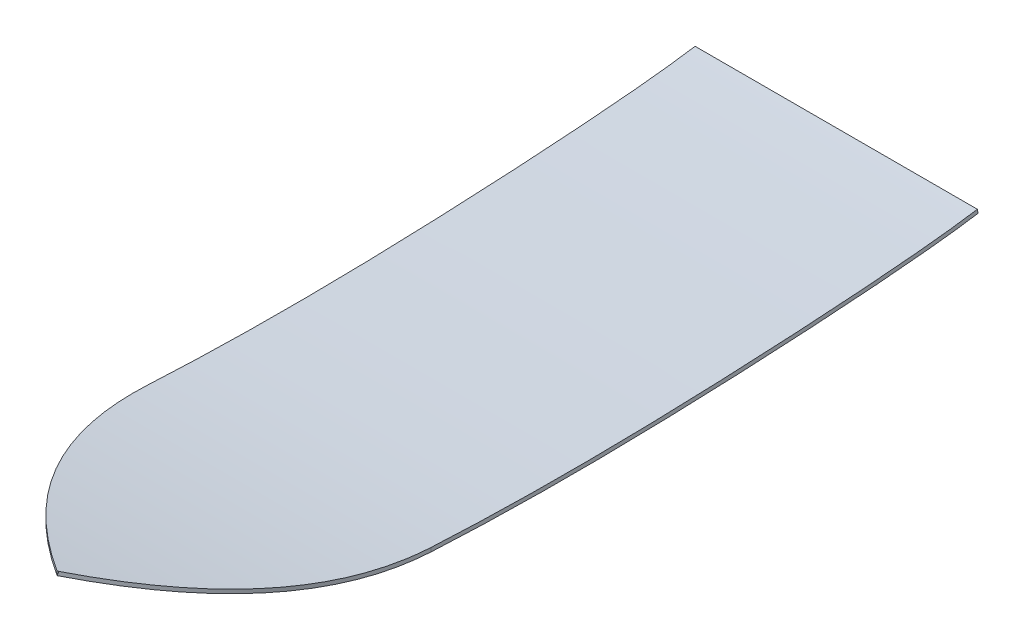
from build123d import *

# Parameters (mm, degrees)
BOSS_EXTRUDE1_DEPTH      = 1524
BOSS_EXTRUDE1_DEPTH_BACK = 1524
CUT_EXTRUDE1_START       = -208
CUT_EXTRUDE1_OUTLINE_W   = 5731.457351091
CUT_EXTRUDE1_OUTLINE_H   = 8003.30588206
CUT_EXTRUDE1_DEPTH       = 209.886455024


with BuildPart() as part:
    # Sketch1 → Boss-Extrude1 (new, two sides: drawn at the far end of the back side and taken through both)
    with BuildSketch(Plane(origin=(0, 0, 0), x_dir=(0, 0, -1), z_dir=(1, 0, 0)).offset(-BOSS_EXTRUDE1_DEPTH_BACK)):
        with BuildLine():
            Line((-2455.705706157, 1.886455024), (-2459.805173453, -22.775142003))
            add(Edge.make_bspline(
                [(-2459.805173453, -22.775142003), (-2441.946686763, -25.743736537), (-2406.205230752, -31.609959996), (-2334.773178672, -43.032277675), (-2209.618030301, -62.250736017), (-2029.595399572, -87.611965707), (-1808.500527735, -114.962754568), (-1616.94740553, -135.317673387), (-1456.702961413, -150.159527585), (-1332.105867361, -160.560262072), (-1223.653948308, -168.603284556), (-1133.367307109, -174.644468748), (-1063.594957076, -178.973267411), (-991.610471894, -183.085221305), (-917.815966885, -186.931442089), (-842.05530735, -190.499530364), (-738.409008772, -194.85598638), (-603.836327416, -199.497545977), (-434.25509535, -203.611966523), (-256.82554217, -206.111379763), (-72.134614073, -206.864893086), (118.81899413, -205.789897599), (314.680946002, -202.868887944), (513.786201944, -198.160071187), (680.992513347, -192.849250504), (814.596522023, -187.864069547), (914.664696552, -183.777270027), (1014.05635537, -179.386503754), (1113.694123204, -174.669692667), (1214.254765944, -169.586653864), (1314.889722078, -164.167290551), (1415.354549259, -158.413962463), (1548.483868307, -150.313072281), (1712.279598249, -139.407922223), (1869.84170335, -127.530715574), (1990.474404012, -117.487059967), (2077.822455966, -109.693479785), (2161.626793075, -101.648998079), (2241.472619675, -93.363479094), (2304.368154422, -86.265806167), (2352.294337899, -80.476044551), (2386.993215338, -76.078820919), (2420.395849105, -71.62753036), (2447.11008498, -67.873534527), (2467.783160775, -64.843949002), (2482.935225878, -62.558183335), (2495.254609712, -60.643431227), (2504.941628256, -59.10257227), (2509.69639179, -58.334346222), (2512.084137374, -57.94546148)],
                knots=[0.00425288, 0.00425288, 0.00425288, 0.00425288, 0.019811429, 0.035369978, 0.066487075, 0.12872127, 0.190955465, 0.25318966, 0.284306758, 0.315423855, 0.346540953, 0.362099501, 0.37765805, 0.393216599, 0.408775148, 0.424333696, 0.439892245, 0.471009343, 0.50212644, 0.533243538, 0.564360635, 0.595477733, 0.62659483, 0.657711928, 0.688829025, 0.704387574, 0.719946123, 0.735504671, 0.75106322, 0.766621769, 0.782180318, 0.797738866, 0.813297415, 0.844414513, 0.87553161, 0.891090159, 0.906648708, 0.922207256, 0.937765805, 0.953324354, 0.961103628, 0.968882903, 0.976662177, 0.984441451, 0.988331088, 0.992220726, 0.996110363, 0.998055181, 1, 1, 1, 1], degree=3))
            Line((2512.084137374, -57.94546148), (2508.065415377, -33.270578025))
            add(Edge.make_bspline(
                [(-2455.705706157, 1.886455024), (-2388.929602109, -9.213655581), (-2250.744614942, -31.095911267), (-2039.321445892, -61.1032213), (-1854.98214429, -84.093463784), (-1703.179383723, -101.008958656), (-1586.564265475, -112.966379977), (-1466.480291321, -124.197022056), (-1342.052175224, -134.694120111), (-1212.159556379, -144.439481622), (-1115.225594648, -150.785587374), (-1044.248637597, -155.028151605), (-996.206812372, -157.781712611), (-904.108920044, -162.657989854), (-776.409659034, -168.46569871), (-615.097110797, -174.152973496), (-445.616143887, -178.387255119), (-268.189584582, -181.00563178), (-83.383877989, -181.872955468), (107.820435108, -180.901593827), (304.065593594, -178.069882642), (470.436048017, -174.203618381), (604.319068721, -170.270918885), (704.955343569, -166.92117838), (805.492254699, -163.200334624), (905.942868978, -159.125155368), (1005.708954605, -154.741943756), (1105.633979393, -150.033823452), (1206.505709289, -144.956734116), (1341.1561451, -137.733577077), (1509.068050272, -127.86346104), (1772.179566985, -110.396256681), (2144.322034369, -80.673928409), (2394.691097211, -51.735502779), (2508.065415377, -33.270578025)],
                knots=[0.00425288, 0.00425288, 0.00425288, 0.00425288, 0.0625, 0.125, 0.1875, 0.21875, 0.25, 0.28125, 0.3125, 0.34375, 0.375, 0.37890625, 0.390625, 0.40625, 0.4375, 0.46875, 0.5, 0.53125, 0.5625, 0.59375, 0.625, 0.65625, 0.671875, 0.6875, 0.703125, 0.71875, 0.734375, 0.75, 0.765625, 0.78125, 0.8125, 0.84375, 0.90625, 1, 1, 1, 1], degree=3))
        make_face()
    extrude(amount=BOSS_EXTRUDE1_DEPTH + BOSS_EXTRUDE1_DEPTH_BACK)

    # Cut-Extrude1: read off the stored shape, not the designer's step
    # Cut-Extrude1 outline → Cut-Extrude1 (cut)
    with BuildSketch(Plane(origin=(0, 0, 0), x_dir=(1, 0, 0), z_dir=(0, 1, 0)).offset(CUT_EXTRUDE1_START)):
        with Locations((-68.124729419, 1370.026388402)):
            Rectangle(CUT_EXTRUDE1_OUTLINE_W, CUT_EXTRUDE1_OUTLINE_H)
        with BuildLine():
            Line((-900, -975.025346812), (-900, 2542.50830374))
            Line((-900, 2542.50830374), (900, 2542.50830374))
            Line((900, 2542.50830374), (900, -975.025346812))
            add(Edge.make_bspline(
                [(900, -975.025346812), (900, -1849.663951996), (0, -2459.805173453)],
                knots=[0, 0, 0, 1, 1, 1], degree=2))
            add(Edge.make_bspline(
                [(-900, -975.025346812), (-900, -1849.663951996), (0, -2459.805173453)],
                knots=[0, 0, 0, 1, 1, 1], degree=2))
        make_face(mode=Mode.SUBTRACT)
    extrude(amount=CUT_EXTRUDE1_DEPTH, mode=Mode.SUBTRACT)


solid = part.part
